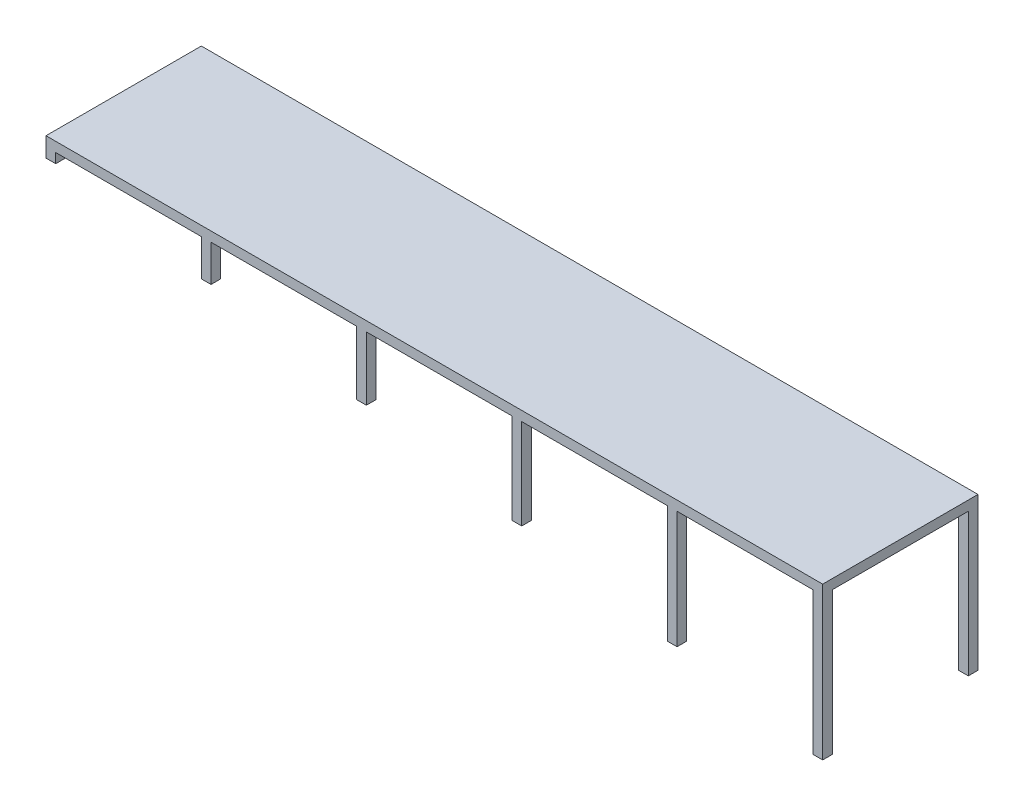
from build123d import *

# Parameters (mm, degrees)
ESBO_O1_W                      = 800
ESBO_O1_H                      = 50
RESSALTO_EXTRUS_O1_DEPTH       = 4000
RESSALTO_EXTRUS_O2_START       = 350
RESSALTO_EXTRUS_O2_OUTLINE_W   = 50
RESSALTO_EXTRUS_O2_OUTLINE_H   = 734.413585936
RESSALTO_EXTRUS_O2_OUTLINE_H_2 = 50
RESSALTO_EXTRUS_O2_OUTLINE_H_3 = 188.61540981
RESSALTO_EXTRUS_O2_OUTLINE_H_4 = 327.23081962
RESSALTO_EXTRUS_O2_OUTLINE_H_5 = 465.84622943
RESSALTO_EXTRUS_O2_OUTLINE_H_6 = 604.461639239
RESSALTO_EXTRUS_O2_DEPTH       = 50


# Read off the part's stored shape, not the designer's step: Ressalto-extrusão2
with BuildPart() as part:
    # Esboço1 → Ressalto-extrusão1 (new body)
    with BuildSketch(Plane(origin=(0, 0, 0), x_dir=(0, 0, -1), z_dir=(1, 0, 0))):
        Rectangle(ESBO_O1_W, ESBO_O1_H)
    extrude(amount=RESSALTO_EXTRUS_O1_DEPTH)

    # Ressalto-extrusão2 outline → Ressalto-extrusão2 (add)
    with BuildSketch(Plane.XY.offset(RESSALTO_EXTRUS_O2_START)):
        with Locations((3975, -392.206792968)):
            Rectangle(RESSALTO_EXTRUS_O2_OUTLINE_W, RESSALTO_EXTRUS_O2_OUTLINE_H)
        with Locations((25, -50)):
            Rectangle(RESSALTO_EXTRUS_O2_OUTLINE_W, RESSALTO_EXTRUS_O2_OUTLINE_H_2)
        with Locations((825, -119.307704905)):
            Rectangle(RESSALTO_EXTRUS_O2_OUTLINE_W, RESSALTO_EXTRUS_O2_OUTLINE_H_3)
        with Locations((1625, -188.61540981)):
            Rectangle(RESSALTO_EXTRUS_O2_OUTLINE_W, RESSALTO_EXTRUS_O2_OUTLINE_H_4)
        with Locations((2425, -257.923114715)):
            Rectangle(RESSALTO_EXTRUS_O2_OUTLINE_W, RESSALTO_EXTRUS_O2_OUTLINE_H_5)
        with Locations((3225, -327.23081962)):
            Rectangle(RESSALTO_EXTRUS_O2_OUTLINE_W, RESSALTO_EXTRUS_O2_OUTLINE_H_6)
    ressalto_extrus_o2 = extrude(amount=RESSALTO_EXTRUS_O2_DEPTH)

    # Espelhar1: Ressalto-extrusão2 across plane
    add(ressalto_extrus_o2.mirror(Plane.XY))


solid = part.part
